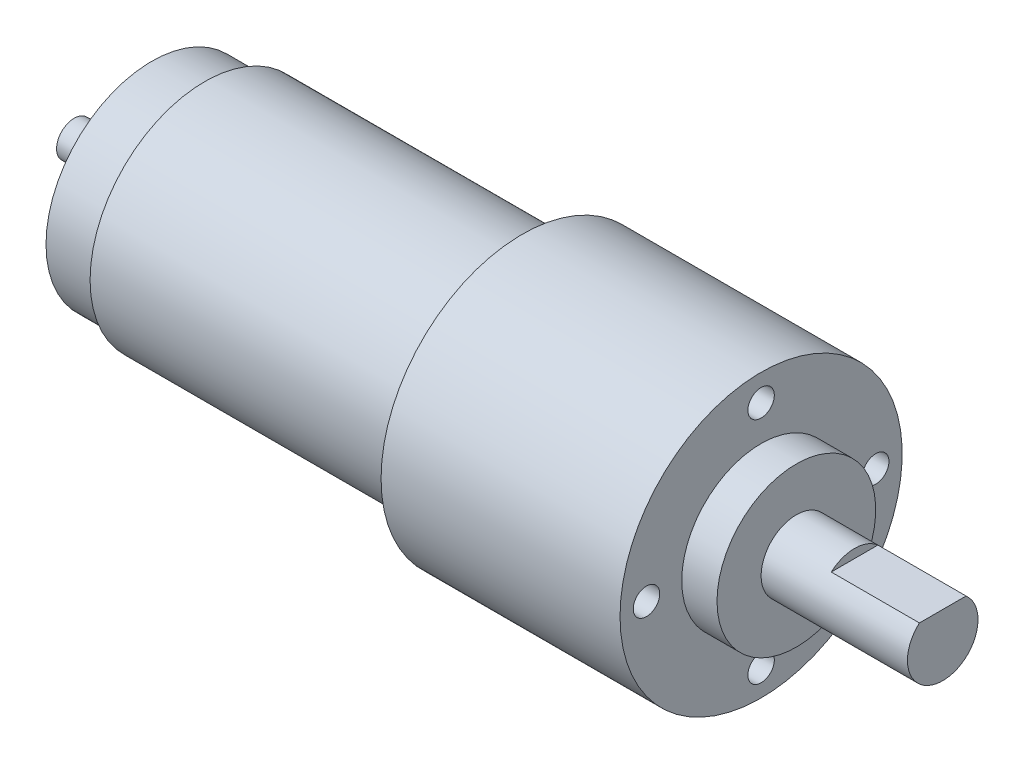
from build123d import *

# Parameters (mm, degrees)
ESQUISSE2_W             = 5.291502622
ESQUISSE2_H             = 1
ENL_V_MAT_EXTRU_1_DEPTH = 10
ESQUISSE3_R             = 1.5
FIXHOLES_DEPTH          = 3
REPEATFIXHOLES_COUNT    = 4


with BuildPart() as part:
    # Esquisse1 → MainRevolution (revolve)
    with BuildSketch(Plane.XY):
        Polygon((0, 0), (98.5, 0), (98.5, 4), (81.9, 4), (81.9, 9), (77.9, 9), (77.9, 16), (50.8, 16), (50.8, 13), (14.8, 13), (14.8, 12), (8.8, 12), (8.8, 2), (0, 2), align=None)
    revolve(axis=Axis((0, 0, 0), (1, 0, 0)))

    # Esquisse2 → Enlèv. mat.-Extru.1 (cut)
    with BuildSketch(Plane(origin=(98.5, 0, 0), x_dir=(0, 0, -1), z_dir=(1, 0, 0))):
        with Locations((0, 3.5)):
            Rectangle(ESQUISSE2_W, ESQUISSE2_H)
    extrude(amount=-ENL_V_MAT_EXTRU_1_DEPTH, mode=Mode.SUBTRACT)

    # Esquisse3 → FixHoles (cut)
    with BuildSketch(Plane(origin=(77.9, 0, 0), x_dir=(0, 0, -1), z_dir=(1, 0, 0))):
        with Locations((0, 13)):
            Circle(ESQUISSE3_R)
    fixholes = extrude(amount=-FIXHOLES_DEPTH, mode=Mode.SUBTRACT)

    # RepeatFixHoles: FixHoles ×4 about axis
    repeatfixholes_axis = Axis((-5.325, 0, 0), (1, 0, 0))
    for i in range(1, REPEATFIXHOLES_COUNT):
        add(fixholes.rotate(repeatfixholes_axis, i * 360 / REPEATFIXHOLES_COUNT), mode=Mode.SUBTRACT)


solid = part.part
